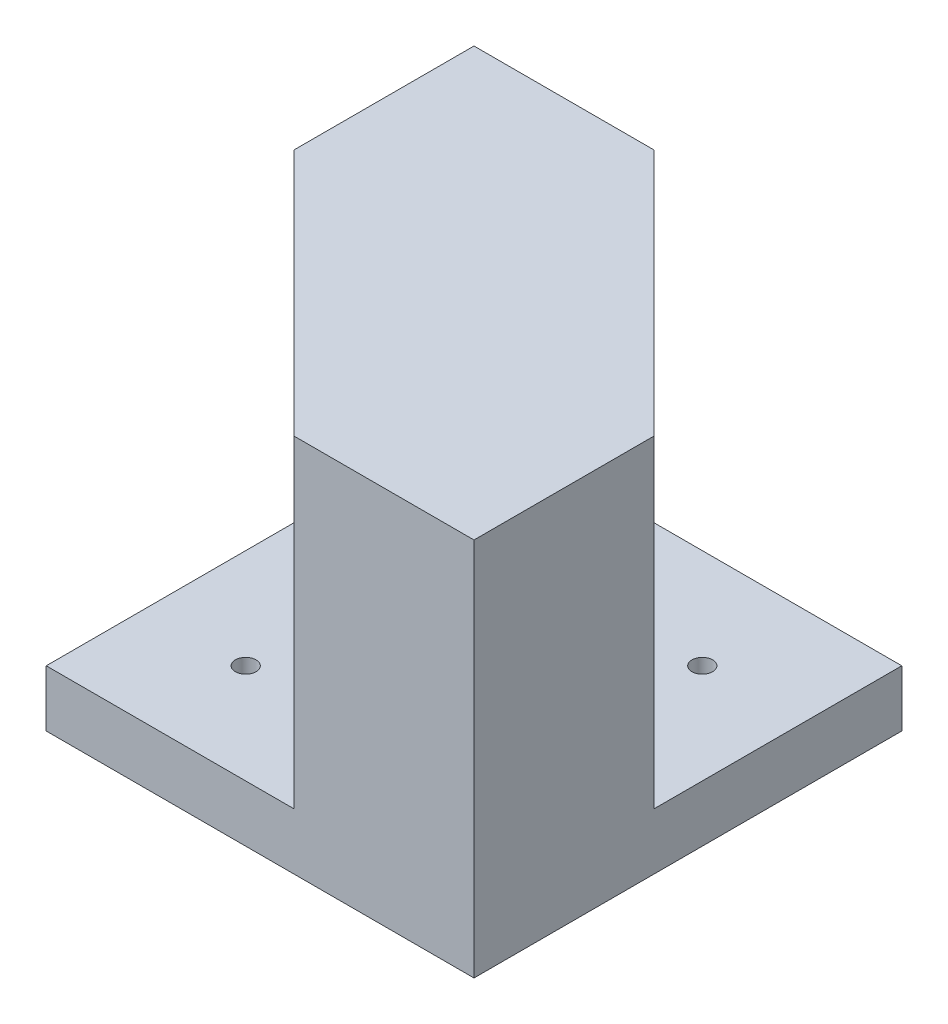
from build123d import *

# Parameters (mm, degrees)
SKETCH1_W           = 67.31
SKETCH1_H           = 67.31
SKETCH1_R           = 1.625
BOSS_EXTRUDE1_DEPTH = 8.89
BOSS_EXTRUDE2_DEPTH = 50.8
SKETCH3_R           = 2
CUT_EXTRUDE2_DEPTH  = 127


with BuildPart() as part:
    # Sketch1 → Boss-Extrude1 (new body)
    with BuildSketch(Plane(origin=(0, 0, 0), x_dir=(1, 0, 0), z_dir=(0, 1, 0))):
        Rectangle(SKETCH1_W, SKETCH1_H)
        with Locations((17.960512242, 17.960512242)):
            Circle(SKETCH1_R, mode=Mode.SUBTRACT)
        with Locations((-17.960512242, -17.960512242)):
            Circle(SKETCH1_R, mode=Mode.SUBTRACT)
    extrude(amount=BOSS_EXTRUDE1_DEPTH)

    # Sketch2 → Boss-Extrude2 (add)
    with BuildSketch(Plane(origin=(0, 8.89, 0), x_dir=(1, 0, 0), z_dir=(0, 1, 0))):
        Polygon((-5.370728753, 33.655), (-33.655, 33.655), (-33.655, 5.370728753), (5.370728753, -33.655), (33.655, -33.655), (33.655, -5.370728753), align=None)
    extrude(amount=BOSS_EXTRUDE2_DEPTH)

    # Sketch3 → Cut-Extrude2 (cut)
    with BuildSketch(Plane(origin=(-14.142135624, 0, 14.142135624), x_dir=(0.7071067811865464, 0, 0.7071067811865488), z_dir=(-0.7071067811865488, 0, 0.7071067811865464))):
        with Locations((-17.960512242, 52.250512242)):
            Circle(SKETCH3_R)
        with Locations((17.960512242, 16.329487758)):
            Circle(SKETCH3_R)
        with Locations((0, 34.29)):
            Circle(SKETCH3_R)
        with Locations((17.960512242, 52.250512242)):
            Circle(SKETCH3_R)
        with Locations((-17.960512242, 16.329487758)):
            Circle(SKETCH3_R)
    extrude(amount=-CUT_EXTRUDE2_DEPTH, mode=Mode.SUBTRACT)


solid = part.part
